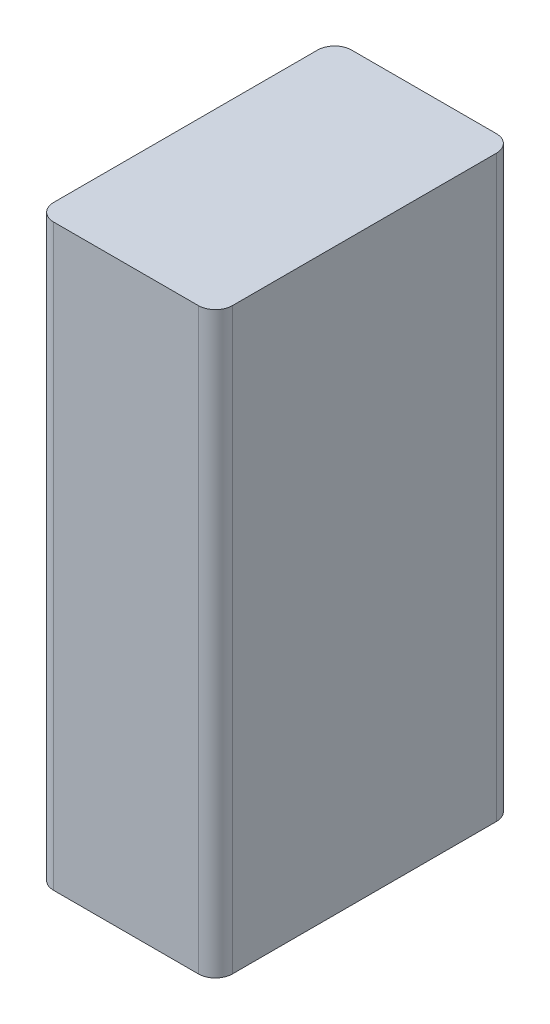
from build123d import *

# Parameters (mm, degrees)
SKETCH1_W           = 21
SKETCH1_H           = 35
BOSS_EXTRUDE1_DEPTH = 68
FILLET1_R           = 2


with BuildPart() as part:
    # Sketch1 → Boss-Extrude1 (new body)
    with BuildSketch(Plane(origin=(0, 0, 0), x_dir=(1, 0, 0), z_dir=(0, 1, 0))):
        with Locations((10.5, 17.5)):
            Rectangle(SKETCH1_W, SKETCH1_H)
    extrude(amount=BOSS_EXTRUDE1_DEPTH)

    # Fillet1
    fillet1_edges = [part.edges().sort_by_distance(p)[0] for p in [
        (0, 34, -35),
        (21, 34, -35),
        (0, 34, 0),
        (21, 34, 0),
    ]]
    fillet(fillet1_edges, radius=FILLET1_R)


solid = part.part
